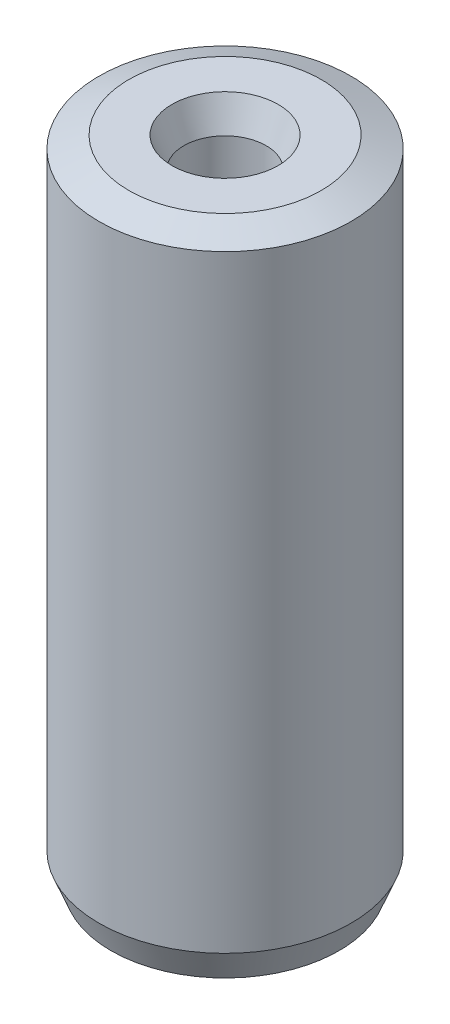
from build123d import *
from OCP.BRepFilletAPI import BRepFilletAPI_MakeChamfer

# Parameters (mm, degrees)
SKETCH1_R           = 5
BOSS_EXTRUDE1_DEPTH = 25.776103789
SKETCH2_R           = 1.632755733
CUT_EXTRUDE1_DEPTH  = 27.728402993
CHAMFER1_SIZE       = 0.474152916
CHAMFER1_SIZE2      = 1.182094032


with BuildPart() as part:
    # Sketch1 → Boss-Extrude1 (new body)
    with BuildSketch(Plane(origin=(0, 0, 0), x_dir=(1, 0, 0), z_dir=(0, 1, 0))):
        Circle(SKETCH1_R)
    extrude(amount=BOSS_EXTRUDE1_DEPTH)

    # Sketch2 → Cut-Extrude1 (cut, through all)
    with BuildSketch(Plane(origin=(0, 0, 0), x_dir=(1, 0, 0), z_dir=(0, 1, 0))):
        Circle(SKETCH2_R)
    extrude(amount=CUT_EXTRUDE1_DEPTH, mode=Mode.SUBTRACT)

    # Chamfer1: one chamfer whose edges measure the first distance from different faces: ONE call of the kernel's chamfer builder (chamfer() names one face for all edges)
    chamfer1_edges_1 = [part.edges().sort_by_distance(p)[0] for p in [
        (-1.632755733, 25.776103789, 0),
    ]]
    chamfer1_side_1 = [part.faces().sort_by_distance(p)[0] for p in [
        (-4.858578644, 25.776103789, 0),
    ]]
    chamfer1_edges_2 = [part.edges().sort_by_distance(p)[0] for p in [
        (-1.632755733, 0, 0),
    ]]
    chamfer1_side_2 = [part.faces().sort_by_distance(p)[0] for p in [
        (-1.632755733, 12.888051895, 0),
    ]]
    chamfer1_edges_3 = [part.edges().sort_by_distance(p)[0] for p in [
        (-5, 0, 0),
    ]]
    chamfer1_side_3 = [part.faces().sort_by_distance(p)[0] for p in [
        (-4.858578644, 0, 0),
    ]]
    chamfer1_edges_4 = [part.edges().sort_by_distance(p)[0] for p in [
        (-5, 25.776103789, 0),
    ]]
    chamfer1_side_4 = [part.faces().sort_by_distance(p)[0] for p in [
        (-5, 12.888051895, 0),
    ]]
    chamfer1 = BRepFilletAPI_MakeChamfer(part.part.solid().wrapped)
    for e in chamfer1_edges_1:
        chamfer1.Add(CHAMFER1_SIZE, CHAMFER1_SIZE2, e.wrapped, chamfer1_side_1[0].wrapped)  # the first distance lies on this face
    for e in chamfer1_edges_2:
        chamfer1.Add(CHAMFER1_SIZE, CHAMFER1_SIZE2, e.wrapped, chamfer1_side_2[0].wrapped)  # the first distance lies on this face
    for e in chamfer1_edges_3:
        chamfer1.Add(CHAMFER1_SIZE, CHAMFER1_SIZE2, e.wrapped, chamfer1_side_3[0].wrapped)  # the first distance lies on this face
    for e in chamfer1_edges_4:
        chamfer1.Add(CHAMFER1_SIZE, CHAMFER1_SIZE2, e.wrapped, chamfer1_side_4[0].wrapped)  # the first distance lies on this face
    add(Compound.cast(chamfer1.Shape()), mode=Mode.REPLACE)


solid = part.part
